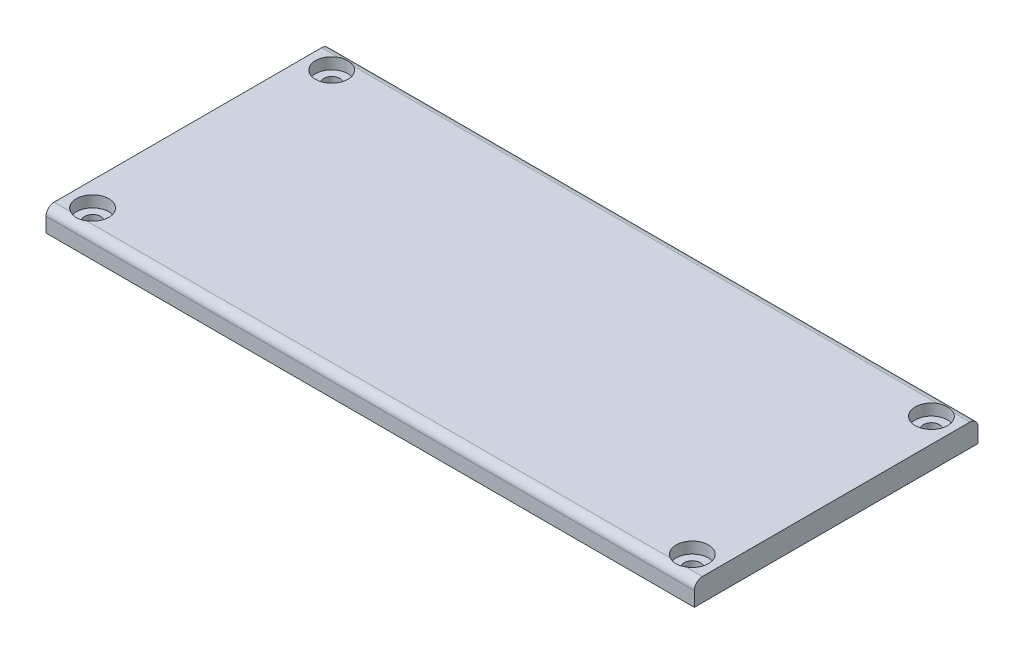
from build123d import *

# Parameters (mm, degrees)
SKETCH_1_W               = 40
SKETCH_1_H               = 17.5
EXTRUDE_1_DEPTH          = 1.4
SKETCH_3_R               = 1
CUT_EXTRUDE_2_DEPTH      = 0.7
SKETCH_4_R               = 0.5
CUT_EXTRUDE_3_DEPTH      = 1.5
MIRROR_2_COPY_1_SKETCH_R = 1
MIRROR_2_COPY_1_DEPTH    = 0.7
MIRROR_2_COPY_2_SKETCH_R = 0.5
MIRROR_2_COPY_2_DEPTH    = 1.5
FILLET_2_R               = 0.5
FILLET_3_R               = 0.5


with BuildPart() as part:
    # 草图1 → 凸台-拉伸1 (new body)
    with BuildSketch(Plane(origin=(0, 0, 0), x_dir=(1, 0, 0), z_dir=(0, 1, 0))):
        with Locations((-1.104564914, -1.754819984)):
            Rectangle(SKETCH_1_W, SKETCH_1_H)
    extrude(amount=EXTRUDE_1_DEPTH)

    # 草图3 → 切除-拉伸2 (cut)
    with BuildSketch(Plane(origin=(0, 1.4, 0), x_dir=(1, 0, 0), z_dir=(0, 1, 0))):
        with Locations(Location((-19.604564914, 5.620180016, 0), (0, 0, 270))):
            Circle(SKETCH_3_R)
    cut_extrude_2 = extrude(amount=-CUT_EXTRUDE_2_DEPTH, mode=Mode.SUBTRACT)

    # 草图4 → 切除-拉伸3 (cut)
    with BuildSketch(Plane(origin=(0, 0.7, 0), x_dir=(1, 0, 0), z_dir=(0, 1, 0))):
        with Locations(Location((-19.604564914, 5.620180016, 0), (0, 0, 270))):
            Circle(SKETCH_4_R)
    cut_extrude_3 = extrude(amount=-CUT_EXTRUDE_3_DEPTH, mode=Mode.SUBTRACT)

    # 镜向1: 切除-拉伸2, 切除-拉伸3 across plane
    add(cut_extrude_2.mirror(Plane.XY.offset(1.754819984)), mode=Mode.SUBTRACT)
    add(cut_extrude_3.mirror(Plane.XY.offset(1.754819984)), mode=Mode.SUBTRACT)

    # 镜向2: 切除-拉伸2, 切除-拉伸3 across plane
    add(cut_extrude_2.mirror(Plane(origin=(-1.104564914, 0, 0), x_dir=(0, 0, 1), z_dir=(1, 0, 0))), mode=Mode.SUBTRACT)
    add(cut_extrude_3.mirror(Plane(origin=(-1.104564914, 0, 0), x_dir=(0, 0, 1), z_dir=(1, 0, 0))), mode=Mode.SUBTRACT)

    # 镜向2 copy 1 sketch → 镜向2 copy 1 (cut)
    with BuildSketch(Plane(origin=(-2.209129827, 1.4, 3.509639969), x_dir=(-1, 0, 0), z_dir=(0, 1, 0))):
        with Locations(Location((-19.604564914, 5.620180016, 0), (0, 0, 270))):
            Circle(MIRROR_2_COPY_1_SKETCH_R)
    extrude(amount=-MIRROR_2_COPY_1_DEPTH, mode=Mode.SUBTRACT)

    # 镜向2 copy 2 sketch → 镜向2 copy 2 (cut)
    with BuildSketch(Plane(origin=(-2.209129827, 0.7, 3.509639969), x_dir=(-1, 0, 0), z_dir=(0, 1, 0))):
        with Locations(Location((-19.604564914, 5.620180016, 0), (0, 0, 270))):
            Circle(MIRROR_2_COPY_2_SKETCH_R)
    extrude(amount=-MIRROR_2_COPY_2_DEPTH, mode=Mode.SUBTRACT)

    # 圆角2
    # the kernel refuses this fillet: 0.5 mm, written as the material it takes off along each edge
    with BuildSketch(Plane(origin=(-22.354564914, 1.4, -6.995180016), x_dir=(0, -1, 0), z_dir=(1, 0, 0))) as fillet_2_piece_1:
        with BuildLine():
            CenterArc((FILLET_2_R, -FILLET_2_R), FILLET_2_R, 90, 90)
            Line((0, -FILLET_2_R), (0, 0))
            Line((0, 0), (FILLET_2_R, 0))
        make_face()
    extrude(amount=42.5, mode=Mode.SUBTRACT)

    # 圆角3
    # the kernel refuses this fillet: 0.5 mm, written as the material it takes off along each edge
    with BuildSketch(Plane(origin=(20.145435086, 1.4, 10.504819984), x_dir=(0, -1, 0), z_dir=(-1, 0, 0))) as fillet_3_piece_1:
        with BuildLine():
            CenterArc((FILLET_3_R, -FILLET_3_R), FILLET_3_R, 90, 90)
            Line((0, -FILLET_3_R), (0, 0))
            Line((0, 0), (FILLET_3_R, 0))
        make_face()
    extrude(amount=42.5, mode=Mode.SUBTRACT)


solid = part.part
